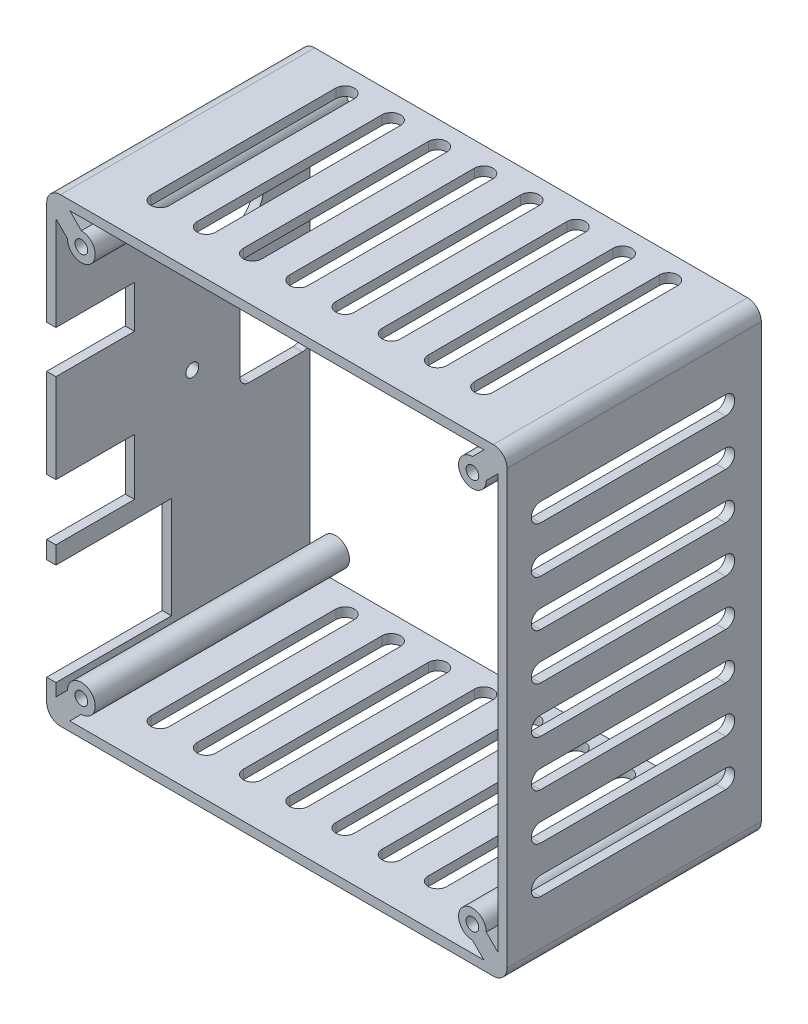
from build123d import *

# Parameters (mm, degrees)
BOSS_EXTRUDE1_DEPTH      = 3
BOSS_EXTRUDE1_DEPTH_BACK = 1.5
SKETCH1_W                = 99.6
SKETCH1_H                = 99.6
SKETCH1_R                = 7.5
SKETCH2_W                = 99.6
SKETCH2_H                = 99.6
SKETCH2_W_2              = 95.6
SKETCH2_H_2              = 95.6
BOSS_EXTRUDE2_DEPTH      = 55
FILLET1_R                = 3
SKETCH5_R                = 3
BOSS_EXTRUDE4_DEPTH      = 55
SKETCH6_R                = 1.375
CUT_EXTRUDE2_DEPTH       = 10
CUT_EXTRUDE4_START       = -99.6
CUT_EXTRUDE4_DEPTH       = 99.6
SKETCH8_W                = 17
SKETCH8_H                = 12.2
SKETCH8_H_2              = 9.2
CUT_EXTRUDE5_DEPTH       = 10
CUT_EXTRUDE13_DEPTH      = 4.5
SKETCH20_7_W             = 13.718214861
SKETCH20_7_H             = 12
CUT_EXTRUDE16_DEPTH      = 4.5
CUT_EXTRUDE17_DEPTH      = 10
SKETCH22_R               = 1.4
CUT_EXTRUDE18_DEPTH      = 10
SKETCH26_R               = 2
CUT_EXTRUDE21_DEPTH      = 4.5
SKETCH29_R               = 2
BOSS_EXTRUDE9_DEPTH      = 4.5
SKETCH30_R               = 2
CUT_EXTRUDE23_DEPTH      = 4.5
CRVPATTERN2_START        = -1.5
CRVPATTERN2_OUTLINE_R    = 2
CRVPATTERN2_DEPTH        = 4.5
SKETCH32_R               = 2
CUT_EXTRUDE24_DEPTH      = 4.5
CRVPATTERN3_START        = -1.5
CRVPATTERN3_OUTLINE_R    = 2
CRVPATTERN3_DEPTH        = 4.5
SKETCH36_R               = 2
CUT_EXTRUDE25_DEPTH      = 4.5
CRVPATTERN4_START        = -1.5
CRVPATTERN4_OUTLINE_R    = 2
CRVPATTERN4_DEPTH        = 4.5
SKETCH37_W               = 26.02554601
SKETCH37_H               = 3
SKETCH37_W_2             = 26.013358107
BOSS_EXTRUDE11_DEPTH     = 4.5
FILLET2_R                = 30
SKETCH38_R               = 2.5
SKETCH38_R_2             = 1.5
BOSS_EXTRUDE12_DEPTH     = 7
CUT_EXTRUDE27_DEPTH      = 2
CUT_EXTRUDE28_START      = 7
SKETCH40_R               = 1.375
CUT_EXTRUDE28_DEPTH      = 7
CUT_EXTRUDE31_DEPTH      = 7
CUT_EXTRUDE33_DEPTH      = 7
BOSS_EXTRUDE13_DEPTH     = 55
SKETCH45_W               = 25
SKETCH45_H               = 22
CUT_EXTRUDE34_DEPTH      = 2
SKETCH46_R               = 7.5
CUT_EXTRUDE35_DEPTH      = 10


# Read off the part's stored shape, not the designer's step: CrvPattern2, CrvPattern3, CrvPattern4
with BuildPart() as part:
    # Sketch1 → Boss-Extrude1 (new, two sides: drawn at the far end of the back side and taken through both)
    with BuildSketch(Plane.XY.offset(-BOSS_EXTRUDE1_DEPTH_BACK)):
        with Locations((-24.95, -0.2)):
            Rectangle(SKETCH1_W, SKETCH1_H)
        with Locations((-21.854673791, 0)):
            Circle(SKETCH1_R, mode=Mode.SUBTRACT)
    extrude(amount=BOSS_EXTRUDE1_DEPTH + BOSS_EXTRUDE1_DEPTH_BACK)

    # Sketch2 → Boss-Extrude2 (add)
    with BuildSketch(Plane.XY.offset(3)):
        with Locations((-24.95, -0.2)):
            Rectangle(SKETCH2_W, SKETCH2_H)
        with Locations((-24.95, -0.2)):
            Rectangle(SKETCH2_W_2, SKETCH2_H_2, mode=Mode.SUBTRACT)
    extrude(amount=BOSS_EXTRUDE2_DEPTH)

    # Fillet1
    fillet1_edges = [part.edges().sort_by_distance(p)[0] for p in [
        (-72.75, -48, 30.5),
        (22.85, -48, 30.5),
        (22.85, 47.6, 30.5),
        (-72.75, 47.6, 30.5),
        (-74.75, 49.6, 28.25),
        (24.85, 49.6, 28.25),
        (24.85, -50, 28.25),
        (-74.75, -50, 28.25),
    ]]
    fillet(fillet1_edges, radius=FILLET1_R)

    # Sketch5 → Boss-Extrude4 (add)
    with BuildSketch(Plane.XY.offset(3)):
        with Locations((17.35, 42.1)):
            Circle(SKETCH5_R)
        with Locations((17.35, -42.5)):
            Circle(SKETCH5_R)
        with Locations((-67.25, 42.1)):
            Circle(SKETCH5_R)
        with Locations((-67.25, -42.5)):
            Circle(SKETCH5_R)
    extrude(amount=BOSS_EXTRUDE4_DEPTH)

    # Sketch6 → Cut-Extrude2 (cut)
    with BuildSketch(Plane.XY.offset(58)):
        with Locations((17.35, 42.1)):
            Circle(SKETCH6_R)
        with Locations((17.35, -42.5)):
            Circle(SKETCH6_R)
        with Locations((-67.25, -42.5)):
            Circle(SKETCH6_R)
        with Locations((-67.25, 42.1)):
            Circle(SKETCH6_R)
    extrude(amount=-CUT_EXTRUDE2_DEPTH, mode=Mode.SUBTRACT)

    # Sketch7 → Cut-Extrude4 (cut)
    with BuildSketch(Plane.XZ.offset(50).offset(CUT_EXTRUDE4_START)):
        with BuildLine():
            Line((12.05, 8.25), (12.05, 48.25))
            ThreePointArc((12.05, 48.25), (10.05, 50.25), (8.05, 48.25))
            Line((8.05, 48.25), (8.05, 8.25))
            ThreePointArc((8.05, 8.25), (10.05, 6.25), (12.05, 8.25))
        make_face()
        with BuildLine():
            Line((-1.95, 8.25), (-1.95, 48.25))
            ThreePointArc((-1.95, 48.25), (0.05, 50.25), (2.05, 48.25))
            Line((2.05, 48.25), (2.05, 8.25))
            ThreePointArc((2.05, 8.25), (0.05, 6.25), (-1.95, 8.25))
        make_face()
        with BuildLine():
            Line((-11.95, 8.25), (-11.95, 48.25))
            ThreePointArc((-11.95, 48.25), (-9.95, 50.25), (-7.95, 48.25))
            Line((-7.95, 48.25), (-7.95, 8.25))
            ThreePointArc((-7.95, 8.25), (-9.95, 6.25), (-11.95, 8.25))
        make_face()
        with BuildLine():
            Line((-21.95, 8.25), (-21.95, 48.25))
            ThreePointArc((-21.95, 48.25), (-19.95, 50.25), (-17.95, 48.25))
            Line((-17.95, 48.25), (-17.95, 8.25))
            ThreePointArc((-17.95, 8.25), (-19.95, 6.25), (-21.95, 8.25))
        make_face()
        with BuildLine():
            Line((-31.95, 8.25), (-31.95, 48.25))
            ThreePointArc((-31.95, 48.25), (-29.95, 50.25), (-27.95, 48.25))
            Line((-27.95, 48.25), (-27.95, 8.25))
            ThreePointArc((-27.95, 8.25), (-29.95, 6.25), (-31.95, 8.25))
        make_face()
        with BuildLine():
            Line((-41.95, 8.25), (-41.95, 48.25))
            ThreePointArc((-41.95, 48.25), (-39.95, 50.25), (-37.95, 48.25))
            Line((-37.95, 48.25), (-37.95, 8.25))
            ThreePointArc((-37.95, 8.25), (-39.95, 6.25), (-41.95, 8.25))
        make_face()
        with BuildLine():
            Line((-51.95, 8.25), (-51.95, 48.25))
            ThreePointArc((-51.95, 48.25), (-49.95, 50.25), (-47.95, 48.25))
            Line((-47.95, 48.25), (-47.95, 8.25))
            ThreePointArc((-47.95, 8.25), (-49.95, 6.25), (-51.95, 8.25))
        make_face()
        with BuildLine():
            Line((-61.95, 8.25), (-61.95, 48.25))
            ThreePointArc((-61.95, 48.25), (-59.95, 50.25), (-57.95, 48.25))
            Line((-57.95, 48.25), (-57.95, 8.25))
            ThreePointArc((-57.95, 8.25), (-59.95, 6.25), (-61.95, 8.25))
        make_face()
    cut_extrude4 = extrude(amount=CUT_EXTRUDE4_DEPTH, mode=Mode.SUBTRACT)

    # Mirror1: Cut-Extrude4 across plane
    add(cut_extrude4.mirror(Plane.ZX), mode=Mode.SUBTRACT)

    # Sketch8 → Cut-Extrude5 (cut)
    with BuildSketch(Plane.ZY.offset(74.75)):
        with Locations((49.5, -10.4)):
            Rectangle(SKETCH8_W, SKETCH8_H)
        with Locations((49.5, 19.6)):
            Rectangle(SKETCH8_W, SKETCH8_H_2)
    extrude(amount=-CUT_EXTRUDE5_DEPTH, mode=Mode.SUBTRACT)

    # Sketch20 → Cut-Extrude13 (cut)
    with BuildSketch(Plane(origin=(0, 0, -1.5), x_dir=(-1, 0, 0), z_dir=(0, 0, -1))):
        with BuildLine():
            ThreePointArc((24.75, -47), (71.75, 0), (24.75, 47))
            Line((24.75, 47), (24.75, 35))
            ThreePointArc((24.75, 35), (59.75, 0), (24.75, -35))
            Line((24.75, -35), (24.75, -47))
        make_face()
    extrude(amount=-CUT_EXTRUDE13_DEPTH, mode=Mode.SUBTRACT)

    # Sketch20<7> → Cut-Extrude16 (cut)
    with BuildSketch(Plane(origin=(0, 0, -1.5), x_dir=(-1, 0, 0), z_dir=(0, 0, -1))):
        with Locations((17.89089257, 41)):
            Rectangle(SKETCH20_7_W, SKETCH20_7_H)
        with Locations((17.89089257, -41)):
            Rectangle(SKETCH20_7_W, SKETCH20_7_H)
    extrude(amount=-CUT_EXTRUDE16_DEPTH, mode=Mode.SUBTRACT)

    # Sketch21 → Cut-Extrude17 (cut)
    with BuildSketch(Plane.ZY.offset(74.75)):
        with BuildLine():
            Line((4.7, -7), (16.2, -7))
            ThreePointArc((16.2, -7), (17.614213562, -6.414213562), (18.2, -5))
            Line((18.2, -5), (18.2, 8))
            ThreePointArc((18.2, 8), (17.614213562, 9.414213562), (16.2, 10))
            Line((16.2, 10), (4.7, 10))
            ThreePointArc((4.7, 10), (3.285786438, 9.414213562), (2.7, 8))
            Line((2.7, 8), (2.7, -5))
            ThreePointArc((2.7, -5), (3.285786438, -6.414213562), (4.7, -7))
        make_face()
    extrude(amount=-CUT_EXTRUDE17_DEPTH, mode=Mode.SUBTRACT)

    # Sketch22 → Cut-Extrude18 (cut)
    with BuildSketch(Plane(origin=(-72.75, 0, 0), x_dir=(0, 0, -1), z_dir=(1, 0, 0))):
        with Locations(Location((-28.5, 1.5, 0), (0, 0, 90))):
            Circle(SKETCH22_R)
    extrude(amount=-CUT_EXTRUDE18_DEPTH, mode=Mode.SUBTRACT)

    # Sketch26 → Cut-Extrude21 (cut)
    with BuildSketch(Plane(origin=(0, 0, -1.5), x_dir=(-1, 0, 0), z_dir=(0, 0, -1))):
        with Locations((-19.85, -45)):
            Circle(SKETCH26_R)
        with Locations((-19.85, -40)):
            Circle(SKETCH26_R)
        with Locations((-19.85, -35)):
            Circle(SKETCH26_R)
        with Locations((-19.85, -30)):
            Circle(SKETCH26_R)
        with Locations((-19.85, -25)):
            Circle(SKETCH26_R)
        with Locations((-19.85, -20)):
            Circle(SKETCH26_R)
        with Locations((-19.85, -15)):
            Circle(SKETCH26_R)
        with Locations((-19.85, -10)):
            Circle(SKETCH26_R)
        with Locations((-19.85, -5)):
            Circle(SKETCH26_R)
        with Locations((-19.85, 0)):
            Circle(SKETCH26_R)
        with Locations((-19.85, 5)):
            Circle(SKETCH26_R)
        with Locations((-19.85, 10)):
            Circle(SKETCH26_R)
        with Locations((-19.85, 15)):
            Circle(SKETCH26_R)
        with Locations((-19.85, 20)):
            Circle(SKETCH26_R)
        with Locations((-19.85, 25)):
            Circle(SKETCH26_R)
        with Locations((-19.85, 30)):
            Circle(SKETCH26_R)
        with Locations((-19.85, 35)):
            Circle(SKETCH26_R)
        with Locations((-19.85, 40)):
            Circle(SKETCH26_R)
        with Locations((-19.85, 45)):
            Circle(SKETCH26_R)
        with Locations((-14.85, -45)):
            Circle(SKETCH26_R)
        with Locations((-9.85, -45)):
            Circle(SKETCH26_R)
        with Locations((-4.85, -45)):
            Circle(SKETCH26_R)
        with Locations((0.15, -45)):
            Circle(SKETCH26_R)
        with Locations((5.15, -45)):
            Circle(SKETCH26_R)
        with Locations((-14.85, -40)):
            Circle(SKETCH26_R)
        with Locations((-9.85, -40)):
            Circle(SKETCH26_R)
        with Locations((-4.85, -40)):
            Circle(SKETCH26_R)
        with Locations((0.15, -40)):
            Circle(SKETCH26_R)
        with Locations((5.15, -40)):
            Circle(SKETCH26_R)
        with Locations((-14.85, -35)):
            Circle(SKETCH26_R)
        with Locations((-9.85, -35)):
            Circle(SKETCH26_R)
        with Locations((-4.85, -35)):
            Circle(SKETCH26_R)
        with Locations((0.15, -35)):
            Circle(SKETCH26_R)
        with Locations((5.15, -35)):
            Circle(SKETCH26_R)
        with Locations((-14.85, -30)):
            Circle(SKETCH26_R)
        with Locations((-9.85, -30)):
            Circle(SKETCH26_R)
        with Locations((-4.85, -30)):
            Circle(SKETCH26_R)
        with Locations((0.15, -30)):
            Circle(SKETCH26_R)
        with Locations((5.15, -30)):
            Circle(SKETCH26_R)
        with Locations((-14.85, -25)):
            Circle(SKETCH26_R)
        with Locations((-9.85, -25)):
            Circle(SKETCH26_R)
        with Locations((-4.85, -25)):
            Circle(SKETCH26_R)
        with Locations((0.15, -25)):
            Circle(SKETCH26_R)
        with Locations((5.15, -25)):
            Circle(SKETCH26_R)
        with Locations((-14.85, -20)):
            Circle(SKETCH26_R)
        with Locations((-9.85, -20)):
            Circle(SKETCH26_R)
        with Locations((-4.85, -20)):
            Circle(SKETCH26_R)
        with Locations((0.15, -20)):
            Circle(SKETCH26_R)
        with Locations((5.15, -20)):
            Circle(SKETCH26_R)
        with Locations((-14.85, -15)):
            Circle(SKETCH26_R)
        with Locations((-9.85, -15)):
            Circle(SKETCH26_R)
        with Locations((-4.85, -15)):
            Circle(SKETCH26_R)
        with Locations((0.15, -15)):
            Circle(SKETCH26_R)
        with Locations((5.15, -15)):
            Circle(SKETCH26_R)
        with Locations((-14.85, -10)):
            Circle(SKETCH26_R)
        with Locations((-9.85, -10)):
            Circle(SKETCH26_R)
        with Locations((-14.85, 0)):
            Circle(SKETCH26_R)
        with Locations((-9.85, 0)):
            Circle(SKETCH26_R)
        with Locations((-14.85, 10)):
            Circle(SKETCH26_R)
        with Locations((-9.85, 10)):
            Circle(SKETCH26_R)
        with Locations((-14.85, 15)):
            Circle(SKETCH26_R)
        with Locations((-9.85, 15)):
            Circle(SKETCH26_R)
        with Locations((-4.85, 15)):
            Circle(SKETCH26_R)
        with Locations((0.15, 15)):
            Circle(SKETCH26_R)
        with Locations((5.15, 15)):
            Circle(SKETCH26_R)
        with Locations((-14.85, 20)):
            Circle(SKETCH26_R)
        with Locations((-9.85, 20)):
            Circle(SKETCH26_R)
        with Locations((-4.85, 20)):
            Circle(SKETCH26_R)
        with Locations((0.15, 20)):
            Circle(SKETCH26_R)
        with Locations((5.15, 20)):
            Circle(SKETCH26_R)
        with Locations((-14.85, 25)):
            Circle(SKETCH26_R)
        with Locations((-9.85, 25)):
            Circle(SKETCH26_R)
        with Locations((-4.85, 25)):
            Circle(SKETCH26_R)
        with Locations((0.15, 25)):
            Circle(SKETCH26_R)
        with Locations((5.15, 25)):
            Circle(SKETCH26_R)
        with Locations((-14.85, 30)):
            Circle(SKETCH26_R)
        with Locations((-9.85, 30)):
            Circle(SKETCH26_R)
        with Locations((-4.85, 30)):
            Circle(SKETCH26_R)
        with Locations((0.15, 30)):
            Circle(SKETCH26_R)
        with Locations((5.15, 30)):
            Circle(SKETCH26_R)
        with Locations((-14.85, 35)):
            Circle(SKETCH26_R)
        with Locations((-9.85, 35)):
            Circle(SKETCH26_R)
        with Locations((-4.85, 35)):
            Circle(SKETCH26_R)
        with Locations((0.15, 35)):
            Circle(SKETCH26_R)
        with Locations((5.15, 35)):
            Circle(SKETCH26_R)
        with Locations((-14.85, 40)):
            Circle(SKETCH26_R)
        with Locations((-9.85, 40)):
            Circle(SKETCH26_R)
        with Locations((-4.85, 40)):
            Circle(SKETCH26_R)
        with Locations((0.15, 40)):
            Circle(SKETCH26_R)
        with Locations((5.15, 40)):
            Circle(SKETCH26_R)
        with Locations((-14.85, 45)):
            Circle(SKETCH26_R)
        with Locations((-9.85, 45)):
            Circle(SKETCH26_R)
        with Locations((-4.85, 45)):
            Circle(SKETCH26_R)
        with Locations((0.15, 45)):
            Circle(SKETCH26_R)
        with Locations((5.15, 45)):
            Circle(SKETCH26_R)
        with Locations((10.15, -30)):
            Circle(SKETCH26_R)
        with Locations((10.15, -25)):
            Circle(SKETCH26_R)
        with Locations((10.15, -20)):
            Circle(SKETCH26_R)
        with Locations((10.15, -15)):
            Circle(SKETCH26_R)
        with Locations((10.15, 15)):
            Circle(SKETCH26_R)
        with Locations((10.15, 20)):
            Circle(SKETCH26_R)
        with Locations((10.15, 25)):
            Circle(SKETCH26_R)
        with Locations((10.15, 30)):
            Circle(SKETCH26_R)
    extrude(amount=-CUT_EXTRUDE21_DEPTH, mode=Mode.SUBTRACT)

    # Sketch29 → Boss-Extrude9 (add)
    with BuildSketch(Plane(origin=(0, 0, -1.5), x_dir=(-1, 0, 0), z_dir=(0, 0, -1))):
        with Locations((-19.85, 40)):
            Circle(SKETCH29_R)
        with Locations((-19.85, 45)):
            Circle(SKETCH29_R)
        with Locations((-14.85, 45)):
            Circle(SKETCH29_R)
        with Locations((-14.85, 40)):
            Circle(SKETCH29_R)
        with Locations((-19.85, -40)):
            Circle(SKETCH29_R)
        with Locations((-19.85, -45)):
            Circle(SKETCH29_R)
        with Locations((-14.85, -45)):
            Circle(SKETCH29_R)
        with Locations((-14.85, -40)):
            Circle(SKETCH29_R)
    extrude(amount=-BOSS_EXTRUDE9_DEPTH)

    # Sketch30 → Cut-Extrude23 (cut)
    with BuildSketch(Plane(origin=(0, 0, -1.5), x_dir=(-1, 0, 0), z_dir=(0, 0, -1))):
        with Locations((14.95, 20)):
            Circle(SKETCH30_R)
    extrude(amount=-CUT_EXTRUDE23_DEPTH, mode=Mode.SUBTRACT)

    # CrvPattern2 outline → CrvPattern2 (cut)
    with BuildSketch(Plane.XY.offset(CRVPATTERN2_START)):
        with Locations((-20.098772525, 19.996958712)):
            Circle(CRVPATTERN2_OUTLINE_R)
        with Locations((-25.178610025, 19.249160844)):
            Circle(CRVPATTERN2_OUTLINE_R)
        with Locations((-29.900648507, 17.232653159)):
            Circle(CRVPATTERN2_OUTLINE_R)
        with Locations((-33.953658998, 14.080343429)):
            Circle(CRVPATTERN2_OUTLINE_R)
        with Locations((-34.197040973, -13.830510009)):
            Circle(CRVPATTERN2_OUTLINE_R)
        with Locations((-30.199618752, -17.05301932)):
            Circle(CRVPATTERN2_OUTLINE_R)
        with Locations((-25.513463448, -19.151566231)):
            Circle(CRVPATTERN2_OUTLINE_R)
        with Locations((-20.447438978, -19.987835773)):
            Circle(CRVPATTERN2_OUTLINE_R)
        with Locations((-15.298790205, -20)):
            Circle(CRVPATTERN2_OUTLINE_R)
    extrude(amount=CRVPATTERN2_DEPTH, mode=Mode.SUBTRACT)

    # Sketch32 → Cut-Extrude24 (cut)
    with BuildSketch(Plane(origin=(0, 0, -1.5), x_dir=(-1, 0, 0), z_dir=(0, 0, -1))):
        with Locations((14.95, 15)):
            Circle(SKETCH32_R)
    extrude(amount=-CUT_EXTRUDE24_DEPTH, mode=Mode.SUBTRACT)

    # CrvPattern3 outline → CrvPattern3 (cut)
    with BuildSketch(Plane.XY.offset(CRVPATTERN3_START)):
        with Locations((-20.542711439, 14.979038974)):
            Circle(CRVPATTERN3_OUTLINE_R)
        with Locations((-25.944978829, 13.660974976)):
            Circle(CRVPATTERN3_OUTLINE_R)
        with Locations((-30.495869297, 10.465481024)):
            Circle(CRVPATTERN3_OUTLINE_R)
        with Locations((-31.033926769, -9.882964974)):
            Circle(CRVPATTERN3_OUTLINE_R)
        with Locations((-26.658269364, -13.3144964)):
            Circle(CRVPATTERN3_OUTLINE_R)
        with Locations((-21.333207406, -14.916214477)):
            Circle(CRVPATTERN3_OUTLINE_R)
        with Locations((-15.743080891, -15)):
            Circle(CRVPATTERN3_OUTLINE_R)
    extrude(amount=CRVPATTERN3_DEPTH, mode=Mode.SUBTRACT)

    # Sketch36 → Cut-Extrude25 (cut)
    with BuildSketch(Plane(origin=(0, 0, -1.5), x_dir=(-1, 0, 0), z_dir=(0, 0, -1))):
        with Locations((14.95, 25)):
            Circle(SKETCH36_R)
    extrude(amount=-CUT_EXTRUDE25_DEPTH, mode=Mode.SUBTRACT)

    # CrvPattern4 outline → CrvPattern4 (cut)
    with BuildSketch(Plane.XY.offset(CRVPATTERN4_START)):
        with Locations((-20.416968875, 24.991101467)):
            Circle(CRVPATTERN4_OUTLINE_R)
        with Locations((-15.61704802, -25)):
            Circle(CRVPATTERN4_OUTLINE_R)
        with Locations((-21.083462946, -24.964412202)):
            Circle(CRVPATTERN4_OUTLINE_R)
        with Locations((-26.467563085, -24.080580271)):
            Circle(CRVPATTERN4_OUTLINE_R)
        with Locations((-42.536029609, -10.285759799)):
            Circle(CRVPATTERN4_OUTLINE_R)
        with Locations((-39.76193826, -14.98406911)):
            Circle(CRVPATTERN4_OUTLINE_R)
        with Locations((-36.034648091, -18.968664596)):
            Circle(CRVPATTERN4_OUTLINE_R)
        with Locations((-31.531695558, -22.049753962)):
            Circle(CRVPATTERN4_OUTLINE_R)
        with Locations((-44.224787982, -5.097524227)):
            Circle(CRVPATTERN4_OUTLINE_R)
        with Locations((-44.747775268, 0.333514117)):
            Circle(CRVPATTERN4_OUTLINE_R)
        with Locations((-44.080080793, 5.74866668)):
            Circle(CRVPATTERN4_OUTLINE_R)
        with Locations((-42.253507854, 10.890001574)):
            Circle(CRVPATTERN4_OUTLINE_R)
        with Locations((-35.522791356, 19.396367001)):
            Circle(CRVPATTERN4_OUTLINE_R)
        with Locations((-39.355058875, 15.512629258)):
            Circle(CRVPATTERN4_OUTLINE_R)
        with Locations((-30.939241982, 22.356226512)):
            Circle(CRVPATTERN4_OUTLINE_R)
        with Locations((-25.822732126, 24.251225217)):
            Circle(CRVPATTERN4_OUTLINE_R)
    extrude(amount=CRVPATTERN4_DEPTH, mode=Mode.SUBTRACT)

    # Sketch37 → Boss-Extrude11 (add)
    with BuildSketch(Plane(origin=(0, 0, -1.5), x_dir=(-1, 0, 0), z_dir=(0, 0, -1))):
        with Locations((24.044558144, -46.86)):
            Rectangle(SKETCH37_W, SKETCH37_H)
        with Locations((24.038464193, 46.863305133)):
            Rectangle(SKETCH37_W_2, SKETCH37_H)
    extrude(amount=-BOSS_EXTRUDE11_DEPTH)

    # Fillet2
    fillet2_edges = [part.edges().sort_by_distance(p)[0] for p in [
        (-37.057331149, -45.36, 0.75),
        (-37.045143246, 45.363305133, 0.75),
    ]]
    fillet(fillet2_edges, radius=FILLET2_R)

    # Sketch38 → Boss-Extrude12 (add)
    # profile 1 of 4: a face of its own
    with BuildSketch(Plane.XY.offset(3)):
        with Locations((-36.604673791, -5)):
            Circle(SKETCH38_R)
        with Locations((-36.604673791, -5)):
            Circle(SKETCH38_R_2, mode=Mode.SUBTRACT)
    # profile 2 of 4: a face of its own
    with BuildSketch(Plane.XY.offset(3)):
        with Locations((-36.604673791, 5)):
            Circle(SKETCH38_R)
        with Locations((-36.604673791, 5)):
            Circle(SKETCH38_R_2, mode=Mode.SUBTRACT)
    # profile 3 of 4: a face of its own
    with BuildSketch(Plane.XY.offset(3)):
        with Locations((13.395326209, 5)):
            Circle(SKETCH38_R)
        with Locations((13.395326209, 5)):
            Circle(SKETCH38_R_2, mode=Mode.SUBTRACT)
    # profile 4 of 4: a face of its own
    with BuildSketch(Plane.XY.offset(3)):
        with Locations((13.395326209, -5)):
            Circle(SKETCH38_R)
        with Locations((13.395326209, -5)):
            Circle(SKETCH38_R_2, mode=Mode.SUBTRACT)
    extrude(amount=BOSS_EXTRUDE12_DEPTH)

    # Sketch39 → Cut-Extrude27 (cut)
    with BuildSketch(Plane(origin=(24.85, 0, 0), x_dir=(0, 0, -1), z_dir=(1, 0, 0))):
        with BuildLine():
            Line((-10.75, 36.8), (-50.75, 36.8))
            ThreePointArc((-50.75, 36.8), (-52.75, 34.8), (-50.75, 32.8))
            Line((-50.75, 32.8), (-10.75, 32.8))
            ThreePointArc((-10.75, 32.8), (-8.75, 34.8), (-10.75, 36.8))
        make_face()
        with BuildLine():
            Line((-50.75, 22.8), (-10.75, 22.8))
            ThreePointArc((-10.75, 22.8), (-8.75, 24.8), (-10.75, 26.8))
            Line((-10.75, 26.8), (-50.75, 26.8))
            ThreePointArc((-50.75, 26.8), (-52.75, 24.8), (-50.75, 22.8))
        make_face()
        with BuildLine():
            Line((-50.75, 12.8), (-10.75, 12.8))
            ThreePointArc((-10.75, 12.8), (-8.75, 14.8), (-10.75, 16.8))
            Line((-10.75, 16.8), (-50.75, 16.8))
            ThreePointArc((-50.75, 16.8), (-52.75, 14.8), (-50.75, 12.8))
        make_face()
        with BuildLine():
            Line((-50.75, 2.8), (-10.75, 2.8))
            ThreePointArc((-10.75, 2.8), (-8.75, 4.8), (-10.75, 6.8))
            Line((-10.75, 6.8), (-50.75, 6.8))
            ThreePointArc((-50.75, 6.8), (-52.75, 4.8), (-50.75, 2.8))
        make_face()
        with BuildLine():
            Line((-50.75, -7.2), (-10.75, -7.2))
            ThreePointArc((-10.75, -7.2), (-8.75, -5.2), (-10.75, -3.2))
            Line((-10.75, -3.2), (-50.75, -3.2))
            ThreePointArc((-50.75, -3.2), (-52.75, -5.2), (-50.75, -7.2))
        make_face()
        with BuildLine():
            Line((-50.75, -17.2), (-10.75, -17.2))
            ThreePointArc((-10.75, -17.2), (-8.75, -15.2), (-10.75, -13.2))
            Line((-10.75, -13.2), (-50.75, -13.2))
            ThreePointArc((-50.75, -13.2), (-52.75, -15.2), (-50.75, -17.2))
        make_face()
        with BuildLine():
            Line((-50.75, -27.2), (-10.75, -27.2))
            ThreePointArc((-10.75, -27.2), (-8.75, -25.2), (-10.75, -23.2))
            Line((-10.75, -23.2), (-50.75, -23.2))
            ThreePointArc((-50.75, -23.2), (-52.75, -25.2), (-50.75, -27.2))
        make_face()
        with BuildLine():
            Line((-50.75, -37.2), (-10.75, -37.2))
            ThreePointArc((-10.75, -37.2), (-8.75, -35.2), (-10.75, -33.2))
            Line((-10.75, -33.2), (-50.75, -33.2))
            ThreePointArc((-50.75, -33.2), (-52.75, -35.2), (-50.75, -37.2))
        make_face()
    extrude(amount=-CUT_EXTRUDE27_DEPTH, mode=Mode.SUBTRACT)

    # Sketch40 → Cut-Extrude28 (cut)
    with BuildSketch(Plane.XY.offset(3).offset(CUT_EXTRUDE28_START)):
        with Locations((17.35, 42.1)):
            Circle(SKETCH40_R)
        with Locations((-67.25, 42.1)):
            Circle(SKETCH40_R)
        with Locations((-67.25, -42.5)):
            Circle(SKETCH40_R)
        with Locations((17.35, -42.5)):
            Circle(SKETCH40_R)
    extrude(amount=-CUT_EXTRUDE28_DEPTH, mode=Mode.SUBTRACT)

    # Sketch41 → Cut-Extrude31 (cut)
    with BuildSketch(Plane.XY.offset(3)):
        Polygon((40.574325003, 47.635477722), (37.561143253, -67.654972022), (-85.296066717, -64.444028673), (-81.952431515, 63.490240903), (40.574325003, 60.287934143), align=None)
    extrude(amount=-CUT_EXTRUDE31_DEPTH, mode=Mode.SUBTRACT)


with BuildPart() as cut_extrude31_piece_1:
    # of the separate pieces the step leaves, piece 1, a body of its own (cut_extrude31_pieces)
    add(part.part.solids().sort_by_distance((-72.75, -45, 3))[0])



with BuildPart() as cut_extrude31_piece_2:
    # of the separate pieces the step leaves, piece 2, a body of its own (cut_extrude31_pieces)
    add(part.part.solids().sort_by_distance((20.35, 42.1, 3))[0])


with BuildPart() as cut_extrude31_piece_3:
    # of the separate pieces the step leaves, piece 3, a body of its own (cut_extrude31_pieces)
    add(part.part.solids().sort_by_distance((20.35, -42.5, 3))[0])


with BuildPart() as cut_extrude31_piece_4:
    # of the separate pieces the step leaves, piece 4, a body of its own (cut_extrude31_pieces)
    add(part.part.solids().sort_by_distance((-64.25, 42.1, 3))[0])


with BuildPart() as cut_extrude31_piece_5:
    # of the separate pieces the step leaves, piece 5, a body of its own (cut_extrude31_pieces)
    add(part.part.solids().sort_by_distance((-64.25, -42.5, 3))[0])


with BuildPart() as cut_extrude31_piece_6:
    # of the separate pieces the step leaves, piece 6, a body of its own (cut_extrude31_pieces)
    add(part.part.solids().sort_by_distance((15.895326209, -5, 3))[0])


with BuildPart() as cut_extrude31_piece_7:
    # of the separate pieces the step leaves, piece 7, a body of its own (cut_extrude31_pieces)
    add(part.part.solids().sort_by_distance((15.895326209, 5, 3))[0])


with BuildPart() as cut_extrude31_piece_8:
    # of the separate pieces the step leaves, piece 8, a body of its own (cut_extrude31_pieces)
    add(part.part.solids().sort_by_distance((-34.104673791, -5, 3))[0])


with BuildPart() as cut_extrude31_piece_9:
    # of the separate pieces the step leaves, piece 9, a body of its own (cut_extrude31_pieces)
    add(part.part.solids().sort_by_distance((-34.104673791, 5, 3))[0])


with BuildPart() as cut_extrude33_tool:
    # Sketch42 → Cut-Extrude33 (new body)
    with BuildSketch(Plane.XY.offset(10)):
        Polygon((17.605940303, 12.098788171), (17.605940303, -17.565875069), (-47.201651415, -12.88486728), (-48.391343705, 14.688852341), align=None)
    extrude(amount=-CUT_EXTRUDE33_DEPTH)


with BuildPart() as cut_extrude31_piece_6_1:
    add(cut_extrude31_piece_6.part)

    # Cut-Extrude33: cut by cut_extrude33_tool
    add(cut_extrude33_tool.part, mode=Mode.SUBTRACT)


with BuildPart() as cut_extrude31_piece_7_1:
    add(cut_extrude31_piece_7.part)

    # Cut-Extrude33: cut by cut_extrude33_tool
    add(cut_extrude33_tool.part, mode=Mode.SUBTRACT)


with BuildPart() as cut_extrude31_piece_8_1:
    add(cut_extrude31_piece_8.part)

    # Cut-Extrude33: cut by cut_extrude33_tool
    add(cut_extrude33_tool.part, mode=Mode.SUBTRACT)


with BuildPart() as cut_extrude31_piece_9_1:
    add(cut_extrude31_piece_9.part)

    # Cut-Extrude33: cut by cut_extrude33_tool
    add(cut_extrude33_tool.part, mode=Mode.SUBTRACT)


with BuildPart() as cut_extrude31_piece_1_1:
    add(cut_extrude31_piece_1.part)

    add(cut_extrude31_piece_2.part)  # Boss-Extrude13 merges Cut-Extrude31 piece 2

    add(cut_extrude31_piece_3.part)  # Boss-Extrude13 merges Cut-Extrude31 piece 3

    add(cut_extrude31_piece_4.part)  # Boss-Extrude13 merges Cut-Extrude31 piece 4

    add(cut_extrude31_piece_5.part)  # Boss-Extrude13 merges Cut-Extrude31 piece 5
    # Sketch43 → Boss-Extrude13 (add)
    with BuildSketch(Plane.XY.offset(58)):
        with BuildLine():
            Line((19.85, -48), (17.35, -45.5))
            ThreePointArc((17.35, -45.5), (19.471320344, -44.621320344), (20.35, -42.5))
            Line((20.35, -42.5), (22.85, -45))
            ThreePointArc((22.85, -45), (21.971320344, -47.121320344), (19.85, -48))
        make_face()
        with BuildLine():
            Line((-69.75, -48), (-67.25, -45.5))
            ThreePointArc((-67.25, -45.5), (-69.371320344, -44.621320344), (-70.25, -42.5))
            Line((-70.25, -42.5), (-72.75, -45))
            ThreePointArc((-72.75, -45), (-71.871320344, -47.121320344), (-69.75, -48))
        make_face()
        with BuildLine():
            Line((17.35, 45.1), (19.85, 47.6))
            ThreePointArc((19.85, 47.6), (21.971320344, 46.721320344), (22.85, 44.6))
            Line((22.85, 44.6), (20.35, 42.1))
            ThreePointArc((20.35, 42.1), (19.471320344, 44.221320344), (17.35, 45.1))
        make_face()
        with BuildLine():
            Line((-72.75, 44.6), (-70.25, 42.1))
            ThreePointArc((-70.25, 42.1), (-69.371320344, 44.221320344), (-67.25, 45.1))
            Line((-67.25, 45.1), (-69.75, 47.6))
            ThreePointArc((-69.75, 47.6), (-71.871320344, 46.721320344), (-72.75, 44.6))
        make_face()
    extrude(amount=-BOSS_EXTRUDE13_DEPTH)

    # Sketch45 → Cut-Extrude34 (cut)
    with BuildSketch(Plane.ZY.offset(74.75)):
        with Locations((45.5, -31.302606258)):
            Rectangle(SKETCH45_W, SKETCH45_H)
    extrude(amount=-CUT_EXTRUDE34_DEPTH, mode=Mode.SUBTRACT)

    # Sketch46 → Cut-Extrude35 (cut)
    with BuildSketch(Plane.ZY.offset(74.75)):
        with Locations(Location((20.5, 28.368703557, 0), (0, 0, 270))):
            Circle(SKETCH46_R)
    extrude(amount=-CUT_EXTRUDE35_DEPTH, mode=Mode.SUBTRACT)


solid = cut_extrude31_piece_1_1.part
